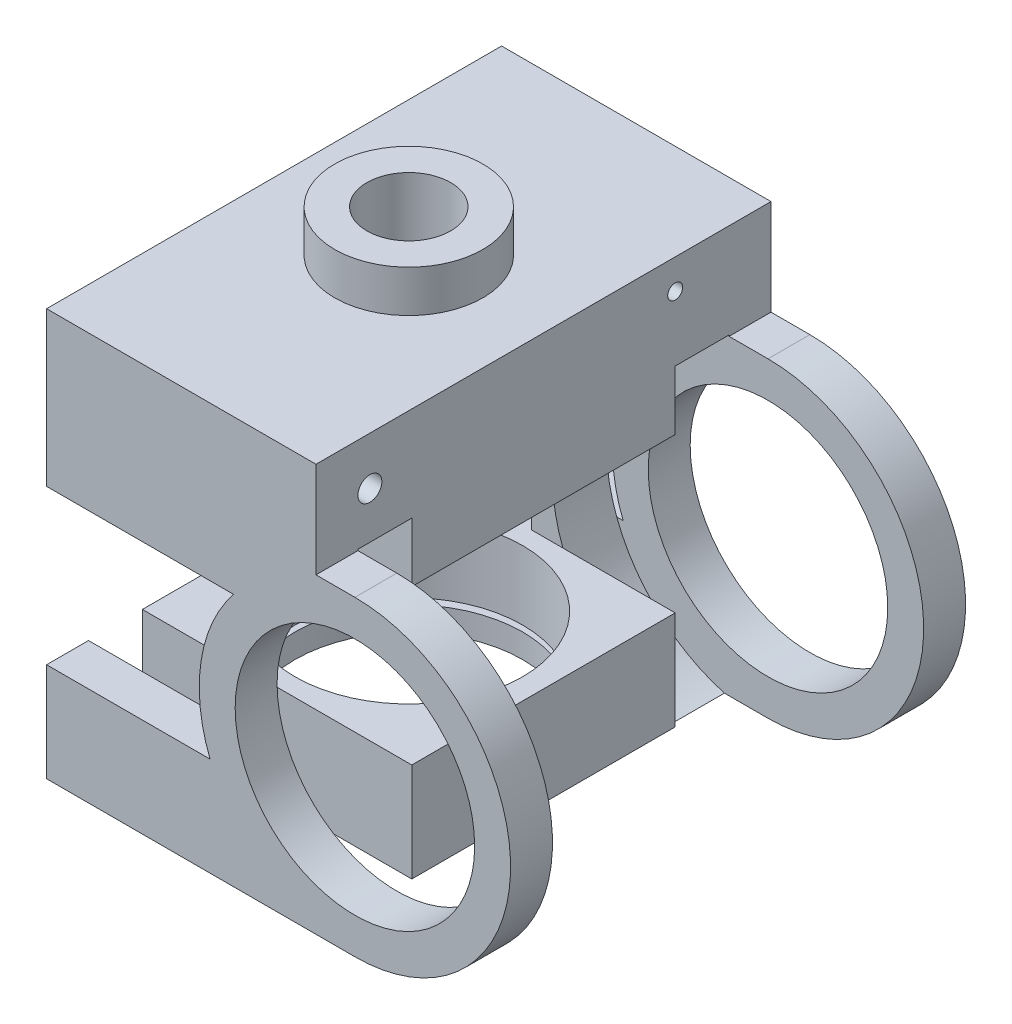
from build123d import *

# Parameters (mm, degrees)
SKETCH4_R                     = 10
BOSS_EXTRUDE4_DEPTH           = 3.5
BOSS_EXTRUDE5_DEPTH           = 4.5
SKETCH6_W                     = 22.5
SKETCH6_H                     = 12.85
SKETCH6_H_2                   = 8.25
BOSS_EXTRUDE6_DEPTH           = 22
BOSS_EXTRUDE7_DEPTH           = 4.5
SKETCH8_R                     = 10
BOSS_EXTRUDE8_DEPTH           = 3.5
SKETCH9_R                     = 6.187039067
BOSS_EXTRUDE9_DEPTH           = 3.5
SKETCH10_R                    = 3.5
CUT_EXTRUDE1_DEPTH            = 9.5
SKETCH11_R                    = 8.5
CUT_EXTRUDE2_DEPTH            = 0.5
CUT_EXTRUDE3_REACH            = 55.51
SKETCH12_R                    = 9.5
CUT_EXTRUDE4_START            = -2
SKETCH13_R                    = 9.5
CUT_EXTRUDE4_DEPTH            = 2
SKETCH14_R                    = 10.5
CUT_EXTRUDE5_DEPTH            = 0.5
CUT_EXTRUDE6_START            = -5.75
SKETCH15_R                    = 9.5
CUT_EXTRUDE6_DEPTH            = 5.75
TAP_DRILL_FOR_M1_6_TAP1_D     = 1.25
TAP_DRILL_FOR_M1_6_TAP1_DEPTH = 5.5
TAP_DRILL_FOR_M1_6_TAP1_TIP   = 0.375537887
F_2_0_2_DIAMETER_HOLE1_D      = 2


with BuildPart() as part:
    # Sketch4 → Boss-Extrude4 (new body)
    with BuildSketch(Plane.XY):
        with BuildLine():
            Line((0, 13), (-3.25, 13))
            Line((-3.25, 13), (-3.25, 21))
            Line((-3.25, 21), (-25.75, 21))
            Line((-25.75, 21), (-25.75, 8.15))
            Line((-25.75, 8.15), (-10.128055095, 8.15))
            ThreePointArc((-10.128055095, 8.15), (-12.850553981, 1.965518347), (-12.10113631, -4.75))
            Line((-12.10113631, -4.75), (-25.75, -4.75))
            Line((-25.75, -4.75), (-25.75, -13))
            Line((-25.75, -13), (0, -13))
            ThreePointArc((0, -13), (13, 0), (0, 13))
        make_face()
        Circle(SKETCH4_R, mode=Mode.SUBTRACT)
    extrude(amount=BOSS_EXTRUDE4_DEPTH)

    # Sketch5 → Boss-Extrude5 (add)
    with BuildSketch(Plane.XY.offset(3.5)):
        with BuildLine():
            Line((-15.25, 8.15), (-25.75, 8.15))
            Line((-25.75, 8.15), (-25.75, 21))
            Line((-25.75, 21), (-3.25, 21))
            Line((-3.25, 21), (-3.25, 13.102957681))
            ThreePointArc((-3.25, 13.102957681), (-13.498493035, 0.201707179), (-3.640054945, -13))
            Line((-3.640054945, -13), (-25.75, -13))
            Line((-25.75, -13), (-25.75, -4.75))
            Line((-25.75, -4.75), (-15.25, -4.75))
            Line((-15.25, -4.75), (-15.25, 8.15))
        make_face()
    extrude(amount=BOSS_EXTRUDE5_DEPTH)

    # Sketch6 → Boss-Extrude6 (add)
    with BuildSketch(Plane.XY.offset(8)):
        with Locations((-14.5, 14.575)):
            Rectangle(SKETCH6_W, SKETCH6_H)
        with Locations((-14.5, -8.875)):
            Rectangle(SKETCH6_W, SKETCH6_H_2)
    extrude(amount=BOSS_EXTRUDE6_DEPTH)

    # Sketch7 → Boss-Extrude7 (add)
    with BuildSketch(Plane.XY.offset(30)):
        with BuildLine():
            Line((-25.75, 21), (-3.25, 21))
            Line((-3.25, 21), (-3.25, 13.102957681))
            ThreePointArc((-3.25, 13.102957681), (-7.430963265, 11.270793448), (-10.762318523, 8.15))
            Line((-10.762318523, 8.15), (-25.75, 8.15))
            Line((-25.75, 8.15), (-25.75, 21))
        make_face()
    extrude(amount=BOSS_EXTRUDE7_DEPTH)

    # Sketch8 → Boss-Extrude8 (add)
    with BuildSketch(Plane.XY.offset(34.5)):
        with BuildLine():
            Line((0, 13), (-3.25, 13))
            Line((-3.25, 13), (-3.25, 21))
            Line((-3.25, 21), (-25.75, 21))
            Line((-25.75, 21), (-25.75, 8.15))
            Line((-25.75, 8.15), (-10.128055095, 8.15))
            ThreePointArc((-10.128055095, 8.15), (-12.850553981, 1.965518347), (-12.10113631, -4.75))
            Line((-12.10113631, -4.75), (-25.75, -4.75))
            Line((-25.75, -4.75), (-25.75, -13))
            Line((-25.75, -13), (0, -13))
            ThreePointArc((0, -13), (13, 0), (0, 13))
        make_face()
        Circle(SKETCH8_R, mode=Mode.SUBTRACT)
    extrude(amount=BOSS_EXTRUDE8_DEPTH)

    # Sketch9 → Boss-Extrude9 (add)
    with BuildSketch(Plane(origin=(0, 21, 0), x_dir=(1, 0, 0), z_dir=(0, 1, 0))):
        with Locations((-14.5, -19)):
            Circle(SKETCH9_R)
    extrude(amount=BOSS_EXTRUDE9_DEPTH)

    # Sketch10 → Cut-Extrude1 (cut)
    with BuildSketch(Plane(origin=(0, 24.5, 0), x_dir=(1, 0, 0), z_dir=(0, 1, 0))):
        with Locations((-14.5, -19)):
            Circle(SKETCH10_R)
    extrude(amount=-CUT_EXTRUDE1_DEPTH, mode=Mode.SUBTRACT)

    # Sketch11 → Cut-Extrude2 (cut)
    with BuildSketch(Plane(origin=(0, 15, 0), x_dir=(1, 0, 0), z_dir=(0, 1, 0))):
        with Locations((-14.5, -19)):
            Circle(SKETCH11_R)
    extrude(amount=-CUT_EXTRUDE2_DEPTH, mode=Mode.SUBTRACT)

    # Sketch12 → Cut-Extrude3 (cut, up to next)
    with BuildSketch(Plane(origin=(0, 14.5, 0), x_dir=(1, 0, 0), z_dir=(0, 1, 0)), mode=Mode.PRIVATE) as cut_extrude3_sk1:
        with Locations((-14.5, -19)):
            Circle(SKETCH12_R)
    cut_extrude3_tool1 = extrude(cut_extrude3_sk1.sketch, amount=-CUT_EXTRUDE3_REACH, mode=Mode.PRIVATE) & part.part
    add(cut_extrude3_tool1.solids().sort_by_distance((-14.5, 14.5, 19))[0], mode=Mode.SUBTRACT)

    # Sketch13 → Cut-Extrude4 (cut)
    with BuildSketch(Plane.XZ.offset(13).offset(CUT_EXTRUDE4_START)):
        with Locations((-14.5, 19)):
            Circle(SKETCH13_R)
    extrude(amount=CUT_EXTRUDE4_DEPTH, mode=Mode.SUBTRACT)

    # Sketch14 → Cut-Extrude5 (cut)
    with BuildSketch(Plane.XZ.offset(11)):
        with Locations((-14.5, 19)):
            Circle(SKETCH14_R)
    extrude(amount=-CUT_EXTRUDE5_DEPTH, mode=Mode.SUBTRACT)

    # Sketch15 → Cut-Extrude6 (cut)
    with BuildSketch(Plane.XZ.offset(10.5).offset(CUT_EXTRUDE6_START)):
        with Locations((-14.5, 19)):
            Circle(SKETCH15_R)
    extrude(amount=CUT_EXTRUDE6_DEPTH, mode=Mode.SUBTRACT)

    # Tap Drill for M1.6 Tap1
    with Locations(Plane(origin=(-3.25, 0, 0), x_dir=(0, 0, -1), z_dir=(1, 0, 0))):
        with Locations((-8, 18.5)):
            Hole(TAP_DRILL_FOR_M1_6_TAP1_D / 2, depth=TAP_DRILL_FOR_M1_6_TAP1_DEPTH)
            with Locations((0, 0, -(TAP_DRILL_FOR_M1_6_TAP1_DEPTH + TAP_DRILL_FOR_M1_6_TAP1_TIP / 2))):  # 118° drill point
                Cone(0, TAP_DRILL_FOR_M1_6_TAP1_D / 2, TAP_DRILL_FOR_M1_6_TAP1_TIP, mode=Mode.SUBTRACT)

    # Ø2.0 (2) Diameter Hole1 (through all)
    with Locations(Plane(origin=(-3.25, 0, 0), x_dir=(0, 0, -1), z_dir=(1, 0, 0))):
        with Locations((-33.5, 17)):
            Hole(F_2_0_2_DIAMETER_HOLE1_D / 2)


solid = part.part
